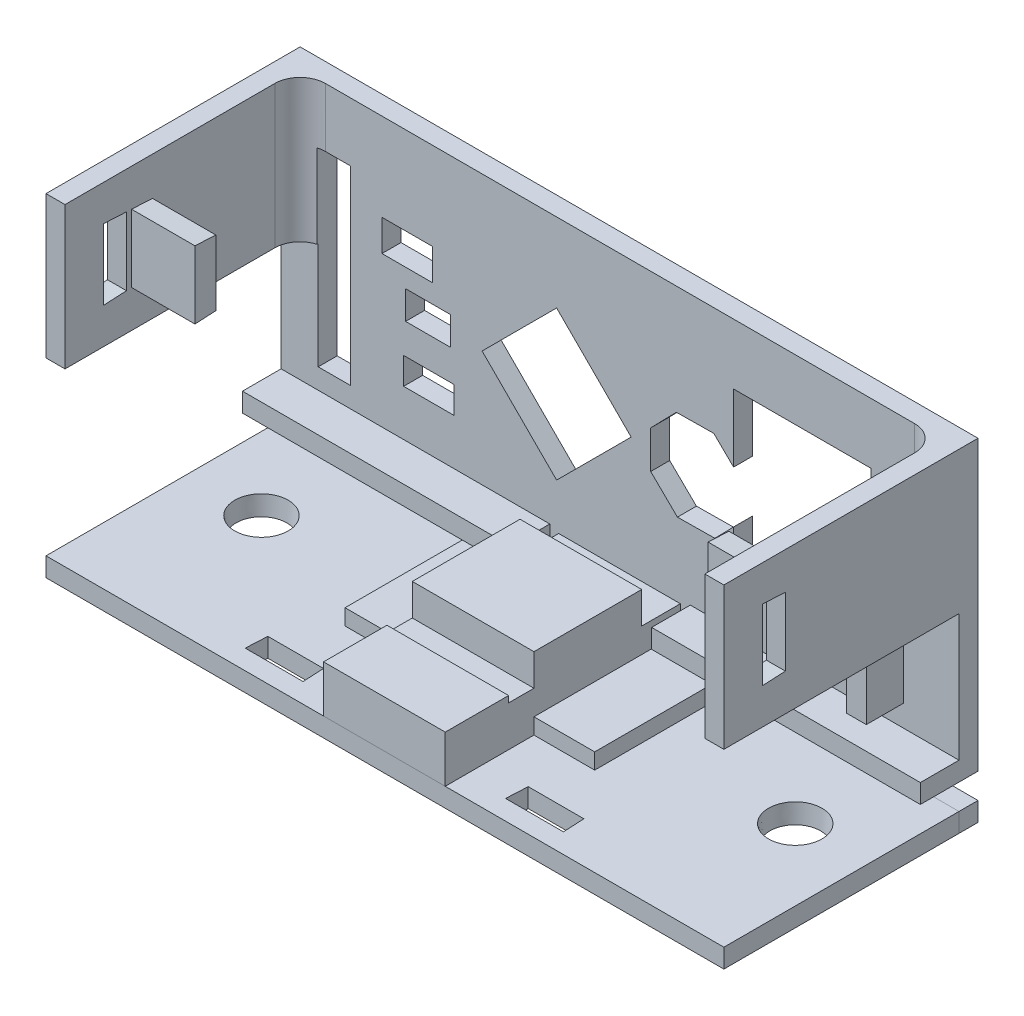
from build123d import *

# Parameters (mm, degrees)
SKETCH1_W                              = 53.48460998
SKETCH1_H                              = 26.25
FRONT_SIDE_MAIN_DEPTH                  = 1.5
RESET_HOLE_DEPTH                       = 3.75
SKETCH15_W                             = 3.966010581
SKETCH15_H                             = 2.112155191
SKETCH15_W_2                           = 3.557190409
SKETCH15_H_2                           = 2.236587576
SKETCH15_W_3                           = 3.981127105
SKETCH15_H_3                           = 2.476855865
COMPONENT_HOLES_DEPTH                  = 3.75
SKETCH16_W                             = 10.85
SKETCH16_H                             = 14.75
MICROPHONE_HOLE_DEPTH                  = 1.5
SKETCH24_W                             = 1.5
SKETCH24_H                             = 11.233042059
RIGHT_SIDE_TOP_DEPTH                   = 18.55
SNAP_GROOVE_RIGHT_DEPTH                = 1.5
SKETCH26_W                             = 1.5
SKETCH26_H                             = 11.233042059
LEFT_SIDE_TOP_DEPTH                    = 18.55
SNAP_START                             = 51.98460998
SNAP_GROOVE_LEFT_DEPTH                 = 1.5
SKETCH20_W                             = 53.48460998
SKETCH20_H                             = 1.5
BOTTOM_BASE_DEPTH                      = 18.55
SERVO_START                            = -1.5
SKETCH18_W                             = 9.6
SKETCH18_H                             = 3.2
SERVO_SEPERATOR_BOTTOM_DEPTH           = 20.05
SKETCH34_W                             = 2.537171882
SKETCH34_H                             = 15
PROGRAMMING_HOLE_DEPTH                 = 3.75
SKETCH38_W                             = 9.6
SKETCH38_H                             = 5
BACK_BATTERY_HOLDER_BOTTOM_DEPTH       = 0.504457941
SKETCH40_R                             = 2
SERVO_ARM_HOLES_BOTTOM_DEPTH           = 1.5
SERVO_ARM_HOLES_BOTTOM_DRAFT           = 4
SERVO_ARM_HOLES_BOTTOM_PROFILE_2_DEPTH = 1.5
SERVO_ARM_HOLES_BOTTOM_PROFILE_2_DRAFT = 4
SKETCH47_W                             = 11
SKETCH47_H                             = 2
SOLAR_ARM_HOLES_FRONT_DEPTH            = 1.5
FILLET1_R                              = 2
SKETCH48_W                             = 9.6
SKETCH48_H                             = 8.5
SERVO_TALLER_SEPERATOR_BOTTOM_DEPTH    = 2.5
SKETCH49_W                             = 1.573389805
SKETCH49_H                             = 10.535992885
SERVO_2_CASE_SPACER_FRONT_DEPTH        = 2.95
SKETCH51_W                             = 4.791370676
SKETCH51_H                             = 11.55
SKETCH51_W_2                           = 5.306259021
SERVO_LIFTERS_BOTTOM_DEPTH             = 1.25
SKETCH52_W                             = 21.2
SKETCH52_H                             = 1.5
SERVO_UNDER_SUPPORT_DEPTH              = 3.05
SERVO_TOP_SUPPORT_RIGHT_DEPTH          = 5
SERVO_TOP_SUPPORT_LEFT_DEPTH           = 5
SNAP_GROOVE_BOTTOM_RIGHT_DEPTH         = 1.5
SNAP_GROOVE_BOTTOM_LEFT_DEPTH          = 1.5


# Read off the part's stored shape, not the designer's step: Snap Groove - Right, Snap Groove - Left, Snap Groove - Bottom Right, Snap Groove - Bottom Left
with BuildPart() as part:
    # Sketch1 → Front Side - Main (new body)
    with BuildSketch(Plane.XY):
        with Locations((26.74230499, 13.125)):
            Rectangle(SKETCH1_W, SKETCH1_H)
    extrude(amount=FRONT_SIDE_MAIN_DEPTH)

    # Reset Hole Sketch → Reset Hole (cut)
    with BuildSketch(Plane(origin=(0, 0, 3.75), x_dir=(-1, 0, 0), z_dir=(0, 0, -1))):
        Polygon((-31.190735744, 17.626168756), (-34.141748042, 17.658585925), (-36.251351249, 15.594827519), (-36.283768419, 12.643815222), (-34.220010013, 10.534212015), (-31.268997715, 10.501794845), (-29.159394508, 12.565553251), (-29.126977338, 15.516565548), align=None)
    extrude(amount=RESET_HOLE_DEPTH, mode=Mode.SUBTRACT)

    # Sketch15 → Component Holes (cut)
    with BuildSketch(Plane(origin=(0, 0, 3.75), x_dir=(-1, 0, 0), z_dir=(0, 0, -1))):
        Polygon((-21.737702993, 20.027277789), (-15.857179586, 14.146754382), (-21.737702993, 8.266230975), (-27.6182264, 14.146754382), align=None)
        with Locations((-11.649935563, 9.695513201)):
            Rectangle(SKETCH15_W, SKETCH15_H)
        with Locations((-11.599935563, 14.270513201)):
            Rectangle(SKETCH15_W_2, SKETCH15_H_2)
        with Locations((-9.949935563, 18.095513201)):
            Rectangle(SKETCH15_W_3, SKETCH15_H_3)
    extrude(amount=COMPONENT_HOLES_DEPTH, mode=Mode.SUBTRACT)

    # Sketch16 → Microphone Hole (cut)
    with BuildSketch(Plane(origin=(0, 0, 0), x_dir=(-1, 0, 0), z_dir=(0, 0, -1))):
        with Locations((-41.124935562, 14.1)):
            Rectangle(SKETCH16_W, SKETCH16_H)
    extrude(amount=-MICROPHONE_HOLE_DEPTH, mode=Mode.SUBTRACT)

    # Sketch24 → Right Side - Top (add)
    with BuildSketch(Plane.XY.offset(1.5)):
        with Locations((0.75, 20.633478971)):
            Rectangle(SKETCH24_W, SKETCH24_H)
    extrude(amount=RIGHT_SIDE_TOP_DEPTH)

    # Snap Groove - Right outline → Snap Groove - Right (cut)
    with BuildSketch(Plane.YZ):
        Polygon((17.938719749, 15.2), (23.328238193, 15.2), (23.422572195, 17), (17.844385746, 17), align=None)
    extrude(amount=SNAP_GROOVE_RIGHT_DEPTH, mode=Mode.SUBTRACT)

    # Sketch26 → Left Side - Top (add)
    with BuildSketch(Plane.XY.offset(1.5)):
        with Locations((52.73460998, 20.633478971)):
            Rectangle(SKETCH26_W, SKETCH26_H)
    extrude(amount=LEFT_SIDE_TOP_DEPTH)

    # Snap Groove - Left outline → Snap Groove - Left (cut)
    with BuildSketch(Plane.YZ.offset(SNAP_START)):
        Polygon((17.938719748, 15.2), (23.328238192, 15.2), (23.422572195, 17), (17.844385746, 17), align=None)
    extrude(amount=SNAP_GROOVE_LEFT_DEPTH, mode=Mode.SUBTRACT)

    # Sketch18 → Servo Seperator - Bottom (add)
    with BuildSketch(Plane.XY.offset(1.5).offset(SERVO_START)):
        with Locations((26.7, 3.1)):
            Rectangle(SKETCH18_W, SKETCH18_H)
    extrude(amount=SERVO_SEPERATOR_BOTTOM_DEPTH)

    # Sketch34 → Programming Hole (cut)
    with BuildSketch(Plane(origin=(0, 0, 0), x_dir=(-1, 0, 0), z_dir=(0, 0, -1))):
        with Locations((-4.194161079, 14.100049249)):
            Rectangle(SKETCH34_W, SKETCH34_H)
    extrude(amount=-PROGRAMMING_HOLE_DEPTH, mode=Mode.SUBTRACT)

    # Sketch38 → Back Battery Holder - Bottom (add)
    with BuildSketch(Plane(origin=(0, 4.7, 0), x_dir=(1, 0, 0), z_dir=(0, 1, 0))):
        with Locations((26.7, -17.55)):
            Rectangle(SKETCH38_W, SKETCH38_H)
    extrude(amount=BACK_BATTERY_HOLDER_BOTTOM_DEPTH)

    # Sketch47 → Solar Arm Holes - Front (cut)
    with BuildSketch(Plane(origin=(0, 0, 0), x_dir=(-1, 0, 0), z_dir=(0, 0, -1))):
        with Locations((-47.98460998, 2.5)):
            Rectangle(SKETCH47_W, SKETCH47_H)
        with Locations((-5.5, 2.5)):
            Rectangle(SKETCH47_W, SKETCH47_H)
    extrude(amount=-SOLAR_ARM_HOLES_FRONT_DEPTH, mode=Mode.SUBTRACT)

    # Fillet1
    # the kernel refuses this fillet: 2 mm, written as the material it adds along each edge
    with BuildSketch(Plane(origin=(1.5, 26.25, 1.5), x_dir=(1, 0, 0), z_dir=(0, -1, 0))) as fillet1_piece_1_section:
        with BuildLine():
            CenterArc((FILLET1_R, FILLET1_R), FILLET1_R, 180, 90)
            Line((0, FILLET1_R), (0, 0))
            Line((0, 0), (FILLET1_R, 0))
        make_face()
    fillet1_piece_1 = extrude(amount=11.233042059, mode=Mode.PRIVATE)
    fillet1_piece_1 = split(fillet1_piece_1, bisect_by=Plane(origin=(3.153594052, 21.600049249, 1.498546269), z_dir=(0, 1, 0)), keep=Keep.TOP, mode=Mode.PRIVATE)
    fillet1_piece_1 = split(fillet1_piece_1, bisect_by=Plane(origin=(2.925575138, 23.925024625, 1.498546269), z_dir=(1, 0, 0)), keep=Keep.TOP, mode=Mode.PRIVATE)
    add(fillet1_piece_1)
    with BuildSketch(Plane(origin=(1.5, 26.25, 1.5), x_dir=(1, 0, 0), z_dir=(0, -1, 0))) as fillet1_piece_2_section:
        with BuildLine():
            CenterArc((FILLET1_R, FILLET1_R), FILLET1_R, 180, 90)
            Line((0, FILLET1_R), (0, 0))
            Line((0, 0), (FILLET1_R, 0))
        make_face()
    fillet1_piece_2 = extrude(amount=11.233042059, mode=Mode.PRIVATE)
    fillet1_piece_2 = split(fillet1_piece_2, bisect_by=Plane(origin=(1.90508607, 21.600049249, 1.970835912), z_dir=(0, 1, 0)), keep=Keep.TOP, mode=Mode.PRIVATE)
    fillet1_piece_2 = split(fillet1_piece_2, bisect_by=Plane(origin=(2.925575138, 23.925024625, 1.970835912), z_dir=(-1, 0, 0)), keep=Keep.TOP, mode=Mode.PRIVATE)
    add(fillet1_piece_2)
    with BuildSketch(Plane(origin=(1.5, 26.25, 1.5), x_dir=(1, 0, 0), z_dir=(0, -1, 0))) as fillet1_piece_3_section:
        with BuildLine():
            CenterArc((FILLET1_R, FILLET1_R), FILLET1_R, 180, 90)
            Line((0, FILLET1_R), (0, 0))
            Line((0, 0), (FILLET1_R, 0))
        make_face()
    fillet1_piece_3 = extrude(amount=11.233042059, mode=Mode.PRIVATE)
    fillet1_piece_3 = split(fillet1_piece_3, bisect_by=Plane(origin=(1.90508607, 21.600049249, 1.970835912), z_dir=(0, -1, 0)), keep=Keep.TOP, mode=Mode.PRIVATE)
    fillet1_piece_3 = split(fillet1_piece_3, bisect_by=Plane(origin=(2.925575138, 18.308503595, 1.970835912), z_dir=(-1, 0, 0)), keep=Keep.TOP, mode=Mode.PRIVATE)
    add(fillet1_piece_3)
    with BuildSketch(Plane(origin=(51.98460998, 26.25, 1.5), x_dir=(-1, 0, 0), z_dir=(0, -1, 0))) as fillet1_piece_4:
        with BuildLine():
            CenterArc((FILLET1_R, -FILLET1_R), FILLET1_R, 90, 90)
            Line((0, -FILLET1_R), (0, 0))
            Line((0, 0), (FILLET1_R, 0))
        make_face()
    extrude(amount=11.233042059)

    # Sketch48 → Servo Taller Seperator - Bottom (add)
    with BuildSketch(Plane(origin=(0, 4.7, 0), x_dir=(1, 0, 0), z_dir=(0, 1, 0))):
        with Locations((26.7, -8.8)):
            Rectangle(SKETCH48_W, SKETCH48_H)
    extrude(amount=SERVO_TALLER_SEPERATOR_BOTTOM_DEPTH)

    # Sketch49 → Servo 2 Case Spacer - Front (add)
    with BuildSketch(Plane.XY.offset(1.5)):
        with Locations((48.336630465, 11.992996443)):
            Rectangle(SKETCH49_W, SKETCH49_H)
    extrude(amount=SERVO_2_CASE_SPACER_FRONT_DEPTH)

    # Sketch51 → Servo Lifters - Bottom (add)
    with BuildSketch(Plane(origin=(0, 1.5, 0), x_dir=(1, 0, 0), z_dir=(0, 1, 0))):
        with Locations((33.895685338, -7.275)):
            Rectangle(SKETCH51_W, SKETCH51_H)
        with Locations((19.24687049, -7.275)):
            Rectangle(SKETCH51_W_2, SKETCH51_H)
    extrude(amount=SERVO_LIFTERS_BOTTOM_DEPTH)

    # Sketch52 → Servo Under Support (add)
    with BuildSketch(Plane.XY.offset(1.5)):
        with Locations((10.6, 4.25)):
            Rectangle(SKETCH52_W, SKETCH52_H)
        with Locations((42.88460998, 4.25)):
            Rectangle(SKETCH52_W, SKETCH52_H)
    extrude(amount=SERVO_UNDER_SUPPORT_DEPTH)

    # Sketch53 → Servo Top Support - Right (add)
    with BuildSketch(Plane(origin=(1.5, 0, 0), x_dir=(0, 0, -1), z_dir=(1, 0, 0))):
        Polygon((-14.8, 23.307275081), (-13.15, 23.220802245), (-13.15, 18.046155696), (-14.8, 17.95968286), align=None)
    extrude(amount=SERVO_TOP_SUPPORT_RIGHT_DEPTH)

    # Sketch55 → Servo Top Support - Left (add)
    with BuildSketch(Plane.ZY.offset(-51.98460998)):
        Polygon((14.8, 17.95968286), (14.8, 23.307275081), (13.15, 23.220802245), (13.15, 18.046155696), align=None)
    extrude(amount=SERVO_TOP_SUPPORT_LEFT_DEPTH)


with BuildPart() as body_2:
    # Sketch20 → Bottom Base (new body)
    with BuildSketch(Plane.XY.offset(1.5)):
        with Locations((26.74230499, 0.75)):
            Rectangle(SKETCH20_W, SKETCH20_H)
    extrude(amount=BOTTOM_BASE_DEPTH)


with BuildPart() as servo_arm_holes_bottom_tool:
    # Sketch40 → Servo arm Holes - Bottom (with draft: the straight prism first)
    with BuildSketch(Plane.XZ):
        with Locations((47.853853261, 8.787851544)):
            Circle(SKETCH40_R)
    extrude(amount=-SERVO_ARM_HOLES_BOTTOM_DEPTH)
    # Servo arm Holes - Bottom: the draft: its side faces are tilted about the plane it starts from
    servo_arm_holes_bottom_sides = [servo_arm_holes_bottom_tool.faces().sort_by_distance(p)[0] for p in [
        (45.853853261, 0.75, 8.787851544),
    ]]
    draft(servo_arm_holes_bottom_sides, Plane.XZ, SERVO_ARM_HOLES_BOTTOM_DRAFT)


with BuildPart() as body_2_1:
    add(body_2.part)

    # Servo arm Holes - Bottom: cut by servo_arm_holes_bottom_tool
    add(servo_arm_holes_bottom_tool.part, mode=Mode.SUBTRACT)


with BuildPart() as servo_arm_holes_bottom_profile_2_tool:
    # Sketch40 → Servo arm Holes - Bottom profile 2 (with draft: the straight prism first)
    with BuildSketch(Plane.XZ):
        with Locations((5.75, 8.8)):
            Circle(SKETCH40_R)
    extrude(amount=-SERVO_ARM_HOLES_BOTTOM_PROFILE_2_DEPTH)
    # Servo arm Holes - Bottom profile 2: the draft: its side faces are tilted about the plane it starts from
    servo_arm_holes_bottom_profile_2_sides = [servo_arm_holes_bottom_profile_2_tool.faces().sort_by_distance(p)[0] for p in [
        (3.75, 0.75, 8.8),
    ]]
    draft(servo_arm_holes_bottom_profile_2_sides, Plane.XZ, SERVO_ARM_HOLES_BOTTOM_PROFILE_2_DRAFT)


with BuildPart() as body_2_2:
    add(body_2_1.part)

    # Servo arm Holes - Bottom profile 2: cut by servo_arm_holes_bottom_profile_2_tool
    add(servo_arm_holes_bottom_profile_2_tool.part, mode=Mode.SUBTRACT)

    # Snap Groove - Bottom Right outline → Snap Groove - Bottom Right (cut)
    with BuildSketch(Plane(origin=(0, 0, 0), x_dir=(1, 0, 0), z_dir=(0, 1, 0))):
        Polygon((14.166147553, -18.5), (18.733852447, -18.5), (18.644759222, -16.8), (14.255240778, -16.8), align=None)
    extrude(amount=SNAP_GROOVE_BOTTOM_RIGHT_DEPTH, mode=Mode.SUBTRACT)

    # Snap Groove - Bottom Left outline → Snap Groove - Bottom Left (cut)
    with BuildSketch(Plane(origin=(0, 0, 0), x_dir=(1, 0, 0), z_dir=(0, 1, 0))):
        Polygon((39.276157437, -18.5), (39.187064212, -16.8), (34.797545768, -16.8), (34.708452543, -18.5), align=None)
    extrude(amount=SNAP_GROOVE_BOTTOM_LEFT_DEPTH, mode=Mode.SUBTRACT)


solid = Compound([part.part, body_2_2.part])
